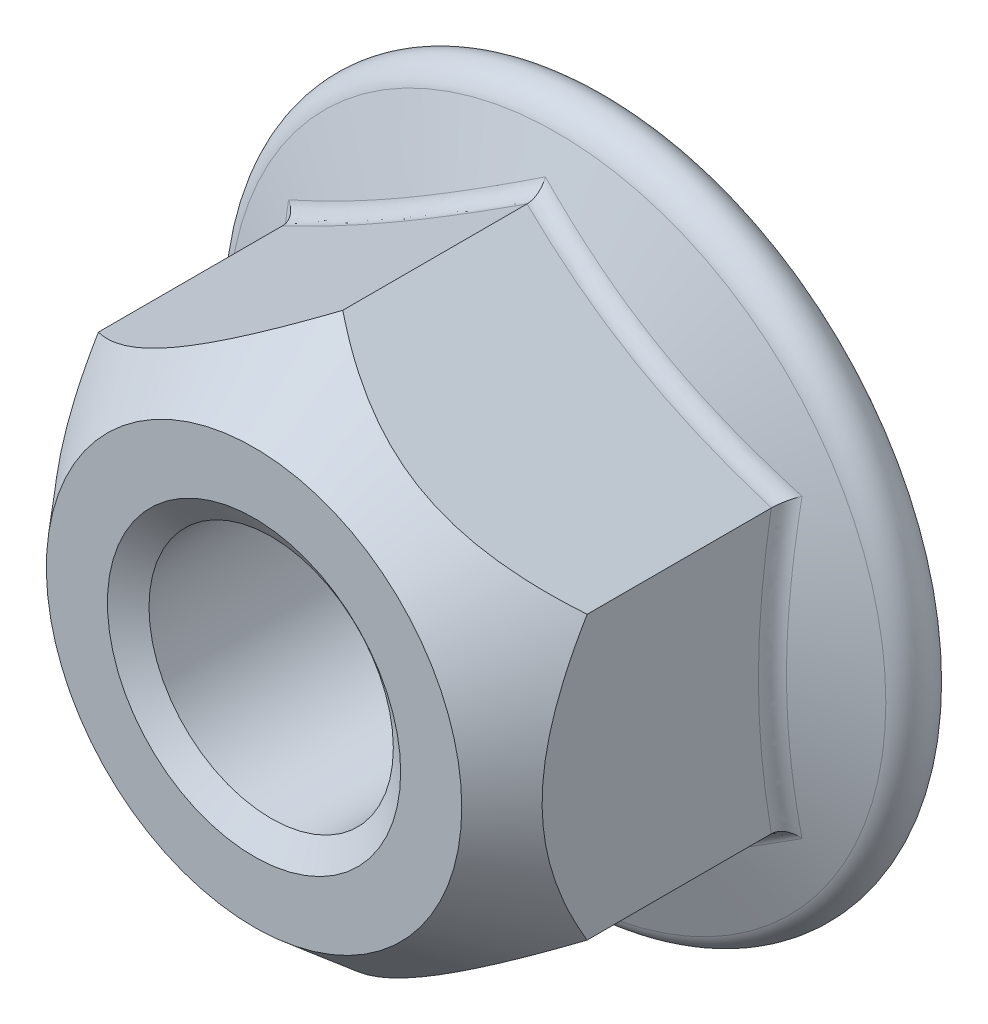
from build123d import *

# Parameters (mm, degrees)
THREADSCHEMATIC_START     = -7.3
THREADSCHEMATIC_OUTLINE_R = 2.5
THREADSCHEMATIC_DEPTH     = 7.3
FLANGEFILLET_R            = 0.36


# Read off the part's stored shape, not the designer's step: ThreadSchematic
with BuildPart() as part:
    # ThreadSchematic outline → ThreadSchematic (new body)
    with BuildSketch(Plane.XY.offset(THREADSCHEMATIC_START)):
        Polygon((5, 2.886751346), (0, 5.773502692), (-5, 2.886751346), (-5, -2.886751346), (0, -5.773502692), (5, -2.886751346), align=None)
        Circle(THREADSCHEMATIC_OUTLINE_R, mode=Mode.SUBTRACT)
    extrude(amount=THREADSCHEMATIC_DEPTH)

    # Sketch6 → Flange (revolve)
    with BuildSketch(Plane(origin=(0, 0, 0), x_dir=(0, 0, -1), z_dir=(1, 0, 0)), mode=Mode.PRIVATE) as flange_sk:
        with BuildLine():
            Line((4.661548952, 2.5), (6.2, 6.726859517))
            ThreePointArc((6.2, 6.726859517), (6.831375747, 7.091384474), (7.3, 6.532899838))
            Line((7.3, 6.532899838), (7.3, 2.5))
            Line((7.3, 2.5), (4.661548952, 2.5))
        make_face()
    revolve(flange_sk.sketch.rotate(Axis((0, 0, 0), (0, 0, -1)), 90), axis=Axis((0, 0, 0), (0, 0, -1)))

    # Sketch3 → Double-Chamfer (revolve, cut)
    with BuildSketch(Plane(origin=(0, 0, 0), x_dir=(0, 0, -1), z_dir=(1, 0, 0)), mode=Mode.PRIVATE) as double_chamfer_sk:
        Polygon((1.815639806, 18.473502692), (-12.7, 18.473502692), (-12.7, 4.25), (0, 4.25), (1.815639806, 5.773502692), align=None)
    revolve(double_chamfer_sk.sketch.rotate(Axis((0, 0, 0), (0, 0, -1)), 300.000000079), axis=Axis((0, 0, 0), (0, 0, -1)), mode=Mode.SUBTRACT)

    # FlangeFillet
    flangefillet_edges = [part.edges().sort_by_distance(p)[0] for p in [
        (5, 1.449672147, -5.64642141),
        (2.5, 4.330127019, -5.571474537),
        (-2.5, 4.330127019, -5.571474537),
        (-5, 0, -5.571474537),
        (-2.5, -4.330127019, -5.571474537),
        (2.5, -4.330127019, -5.571474537),
        (5, -1.449672147, -5.64642141),
    ]]
    fillet(flangefillet_edges, radius=FLANGEFILLET_R)

    # Sketch5 → EndChamfer (revolve, cut)
    with BuildSketch(Plane(origin=(0, 0, 0), x_dir=(0, 0, -1), z_dir=(1, 0, 0)), mode=Mode.PRIVATE) as endchamfer_sk:
        Polygon((7.2746, 3), (6.889485854, 2.45), (7.3254, 2.45), (7.3254, 3), align=None)
        Polygon((-0.0508, 3), (0, 3), (0.385114146, 2.45), (-0.0508, 2.45), align=None)
    revolve(endchamfer_sk.sketch.rotate(Axis((0, 0, -25.037505729), (0, 0, -1)), 90), axis=Axis((0, 0, -25.037505729), (0, 0, -1)), mode=Mode.SUBTRACT)


solid = part.part
